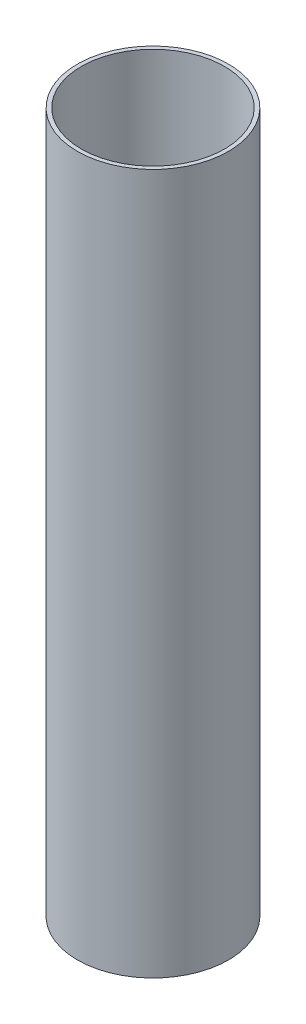
from build123d import *

# Parameters (mm, degrees)
SKETCH2_R           = 60.325
SKETCH2_R_2         = 57.15
BOSS_EXTRUDE1_DEPTH = 558.8


with BuildPart() as part:
    # Sketch2 → Boss-Extrude1 (new body)
    with BuildSketch(Plane(origin=(0, 0, 0), x_dir=(1, 0, 0), z_dir=(0, 1, 0))):
        Circle(SKETCH2_R)
        Circle(SKETCH2_R_2, mode=Mode.SUBTRACT)
    extrude(amount=BOSS_EXTRUDE1_DEPTH)


solid = part.part
